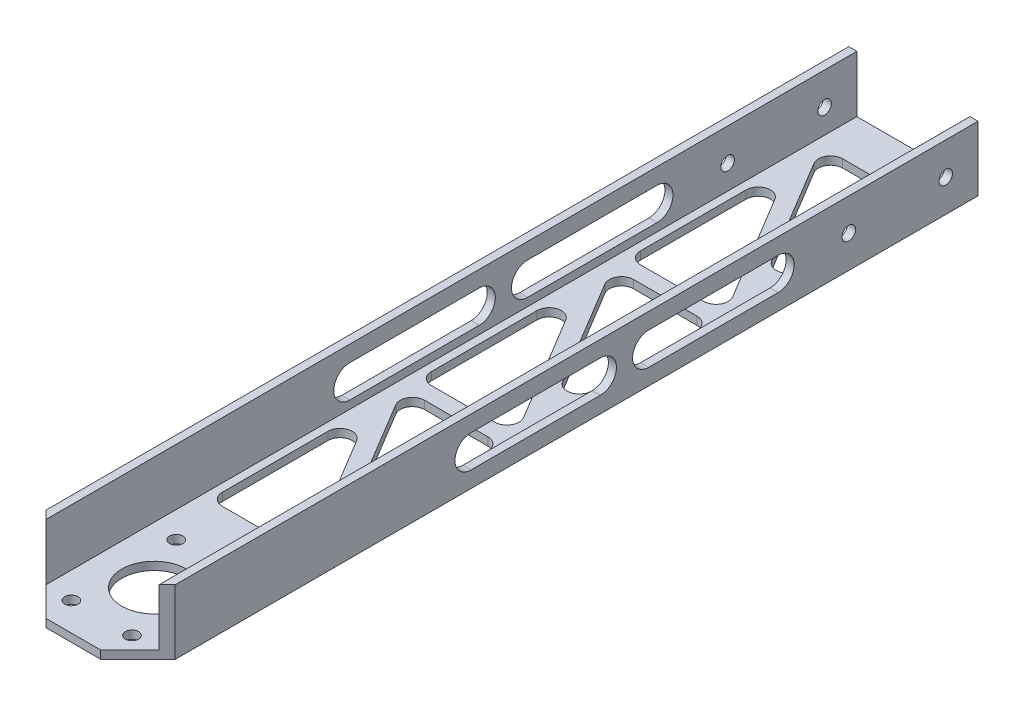
from build123d import *

# Parameters (mm, degrees)
BOSS_EXTRUDE1_DEPTH = 330.2
CUT_EXTRUDE1_REACH  = 337.049
SKETCH2_R           = 12.7
SKETCH3_R           = 2.667
CUT_EXTRUDE2_DEPTH  = 336.04901134
CUT_EXTRUDE3_REACH  = 337.049
SKETCH4_R           = 2.5908
CUT_EXTRUDE4_REACH  = 337.049
CUT_EXTRUDE5_DEPTH  = 336.04901134
CUT_EXTRUDE6_DEPTH  = 336.04901134


with BuildPart() as part:
    # Sketch1 → Boss-Extrude1 (new body)
    with BuildSketch(Plane.XY):
        Polygon((47.625, 3.175), (47.625, 25.4), (50.8, 25.4), (50.8, 0), (0, 0), (0, 25.4), (3.175, 25.4), (3.175, 3.175), align=None)
    extrude(amount=BOSS_EXTRUDE1_DEPTH)

    # Sketch2 → Cut-Extrude1 (cut, up to next)
    with BuildSketch(Plane.XZ, mode=Mode.PRIVATE) as cut_extrude1_sk1:
        with Locations((25.4, 298.45)):
            Circle(SKETCH2_R)
    cut_extrude1_tool1 = extrude(cut_extrude1_sk1.sketch, amount=-CUT_EXTRUDE1_REACH, mode=Mode.PRIVATE) & part.part
    add(cut_extrude1_tool1.solids().sort_by_distance((25.4, 0, 298.45))[0], mode=Mode.SUBTRACT)

    # Sketch3 → Cut-Extrude2 (cut, through all)
    with BuildSketch(Plane(origin=(50.8, 0, 0), x_dir=(0, 0, -1), z_dir=(1, 0, 0))):
        with Locations((-12.7, 12.7)):
            Circle(SKETCH3_R)
        with Locations((-50.8, 12.7)):
            Circle(SKETCH3_R)
    extrude(amount=-CUT_EXTRUDE2_DEPTH, mode=Mode.SUBTRACT)

    # Sketch4 → Cut-Extrude3 (cut, up to next)
    with BuildSketch(Plane.XZ, mode=Mode.PRIVATE) as cut_extrude3_sk1:
        with Locations((13.49375, 277.827770072)):
            Circle(SKETCH4_R)
    cut_extrude3_tool1 = extrude(cut_extrude3_sk1.sketch, amount=-CUT_EXTRUDE3_REACH, mode=Mode.PRIVATE) & part.part
    # Sketch4 → Cut-Extrude3 (cut, up to next)
    with BuildSketch(Plane.XZ, mode=Mode.PRIVATE) as cut_extrude3_sk2:
        with Locations((37.30625, 277.827770072)):
            Circle(SKETCH4_R)
    cut_extrude3_tool2 = extrude(cut_extrude3_sk2.sketch, amount=-CUT_EXTRUDE3_REACH, mode=Mode.PRIVATE) & part.part
    # Sketch4 → Cut-Extrude3 (cut, up to next)
    with BuildSketch(Plane.XZ, mode=Mode.PRIVATE) as cut_extrude3_sk3:
        with Locations((13.49375, 319.072229928)):
            Circle(SKETCH4_R)
    cut_extrude3_tool3 = extrude(cut_extrude3_sk3.sketch, amount=-CUT_EXTRUDE3_REACH, mode=Mode.PRIVATE) & part.part
    # Sketch4 → Cut-Extrude3 (cut, up to next)
    with BuildSketch(Plane.XZ, mode=Mode.PRIVATE) as cut_extrude3_sk4:
        with Locations((37.30625, 319.072229928)):
            Circle(SKETCH4_R)
    cut_extrude3_tool4 = extrude(cut_extrude3_sk4.sketch, amount=-CUT_EXTRUDE3_REACH, mode=Mode.PRIVATE) & part.part
    add(cut_extrude3_tool1.solids().sort_by_distance((13.49375, 0, 277.82777))[0], mode=Mode.SUBTRACT)
    add(cut_extrude3_tool2.solids().sort_by_distance((37.30625, 0, 277.82777))[0], mode=Mode.SUBTRACT)
    add(cut_extrude3_tool3.solids().sort_by_distance((13.49375, 0, 319.07223))[0], mode=Mode.SUBTRACT)
    add(cut_extrude3_tool4.solids().sort_by_distance((37.30625, 0, 319.07223))[0], mode=Mode.SUBTRACT)

    # Sketch5 → Cut-Extrude4 (cut, up to next)
    with BuildSketch(Plane.XZ, mode=Mode.PRIVATE) as cut_extrude4_sk1:
        with BuildLine():
            Line((40.122328379, 85.773383183), (15.196310059, 44.230019316))
            ThreePointArc((15.196310059, 44.230019316), (9.841228816, 42.090613006), (6.35, 46.680305352))
            Line((6.35, 46.680305352), (6.35, 88.223669219))
            ThreePointArc((6.35, 88.223669219), (7.744903955, 91.591265264), (11.1125, 92.986169219))
            Line((11.1125, 92.986169219), (36.03851832, 92.986169219))
            ThreePointArc((36.03851832, 92.986169219), (40.182845376, 90.570147325), (40.122328379, 85.773383183))
        make_face()
    cut_extrude4_tool1 = extrude(cut_extrude4_sk1.sketch, amount=-CUT_EXTRUDE4_REACH, mode=Mode.PRIVATE) & part.part
    # Sketch5 → Cut-Extrude4 (cut, up to next)
    with BuildSketch(Plane.XZ, mode=Mode.PRIVATE) as cut_extrude4_sk2:
        with BuildLine():
            Line((14.76148168, 17.143987708), (39.6875, 17.143987708))
            ThreePointArc((39.6875, 17.143987708), (43.055096045, 18.538891662), (44.45, 21.906487708))
            Line((44.45, 21.906487708), (44.45, 63.449851575))
            ThreePointArc((44.45, 63.449851575), (40.958771184, 68.03954392), (35.603689941, 65.90013761))
            Line((35.603689941, 65.90013761), (10.677671621, 24.356773743))
            ThreePointArc((10.677671621, 24.356773743), (10.617154624, 19.560009601), (14.76148168, 17.143987708))
        make_face()
    cut_extrude4_tool2 = extrude(cut_extrude4_sk2.sketch, amount=-CUT_EXTRUDE4_REACH, mode=Mode.PRIVATE) & part.part
    # Sketch5 → Cut-Extrude4 (cut, up to next)
    with BuildSketch(Plane.XZ, mode=Mode.PRIVATE) as cut_extrude4_sk3:
        with BuildLine():
            Line((40.122328379, 167.965564694), (15.196310059, 126.422200827))
            ThreePointArc((15.196310059, 126.422200827), (9.841228816, 124.282794517), (6.35, 128.872486862))
            Line((6.35, 128.872486862), (6.35, 170.415850729))
            ThreePointArc((6.35, 170.415850729), (7.744903955, 173.783446775), (11.1125, 175.178350729))
            Line((11.1125, 175.178350729), (36.03851832, 175.178350729))
            ThreePointArc((36.03851832, 175.178350729), (40.182845376, 172.762328836), (40.122328379, 167.965564694))
        make_face()
    cut_extrude4_tool3 = extrude(cut_extrude4_sk3.sketch, amount=-CUT_EXTRUDE4_REACH, mode=Mode.PRIVATE) & part.part
    # Sketch5 → Cut-Extrude4 (cut, up to next)
    with BuildSketch(Plane.XZ, mode=Mode.PRIVATE) as cut_extrude4_sk4:
        with BuildLine():
            Line((14.76148168, 99.336169219), (39.6875, 99.336169219))
            ThreePointArc((39.6875, 99.336169219), (43.055096045, 100.731073173), (44.45, 104.098669219))
            Line((44.45, 104.098669219), (44.45, 145.642033085))
            ThreePointArc((44.45, 145.642033085), (40.958771184, 150.231725431), (35.603689941, 148.092319121))
            Line((35.603689941, 148.092319121), (10.677671621, 106.548955254))
            ThreePointArc((10.677671621, 106.548955254), (10.617154624, 101.752191112), (14.76148168, 99.336169219))
        make_face()
    cut_extrude4_tool4 = extrude(cut_extrude4_sk4.sketch, amount=-CUT_EXTRUDE4_REACH, mode=Mode.PRIVATE) & part.part
    # Sketch5 → Cut-Extrude4 (cut, up to next)
    with BuildSketch(Plane.XZ, mode=Mode.PRIVATE) as cut_extrude4_sk5:
        with BuildLine():
            Line((40.122328379, 250.157746205), (15.196310059, 208.614382338))
            ThreePointArc((15.196310059, 208.614382338), (9.841228816, 206.474976028), (6.35, 211.064668373))
            Line((6.35, 211.064668373), (6.35, 252.60803224))
            ThreePointArc((6.35, 252.60803224), (7.744903955, 255.975628285), (11.1125, 257.37053224))
            Line((11.1125, 257.37053224), (36.03851832, 257.37053224))
            ThreePointArc((36.03851832, 257.37053224), (40.182845376, 254.954510346), (40.122328379, 250.157746205))
        make_face()
    cut_extrude4_tool5 = extrude(cut_extrude4_sk5.sketch, amount=-CUT_EXTRUDE4_REACH, mode=Mode.PRIVATE) & part.part
    # Sketch5 → Cut-Extrude4 (cut, up to next)
    with BuildSketch(Plane.XZ, mode=Mode.PRIVATE) as cut_extrude4_sk6:
        with BuildLine():
            Line((14.76148168, 181.528350729), (39.6875, 181.528350729))
            ThreePointArc((39.6875, 181.528350729), (43.055096045, 182.923254684), (44.45, 186.290850729))
            Line((44.45, 186.290850729), (44.45, 227.834214596))
            ThreePointArc((44.45, 227.834214596), (40.958771184, 232.423906942), (35.603689941, 230.284500631))
            Line((35.603689941, 230.284500631), (10.677671621, 188.741136765))
            ThreePointArc((10.677671621, 188.741136765), (10.617154624, 183.944372623), (14.76148168, 181.528350729))
        make_face()
    cut_extrude4_tool6 = extrude(cut_extrude4_sk6.sketch, amount=-CUT_EXTRUDE4_REACH, mode=Mode.PRIVATE) & part.part
    add(cut_extrude4_tool1.solids().sort_by_distance((19.256233, 0, 73.00095))[0], mode=Mode.SUBTRACT)
    add(cut_extrude4_tool2.solids().sort_by_distance((31.543767, 0, 37.129207))[0], mode=Mode.SUBTRACT)
    add(cut_extrude4_tool3.solids().sort_by_distance((19.256233, 0, 155.193132))[0], mode=Mode.SUBTRACT)
    add(cut_extrude4_tool4.solids().sort_by_distance((31.543767, 0, 119.321388))[0], mode=Mode.SUBTRACT)
    add(cut_extrude4_tool5.solids().sort_by_distance((19.256233, 0, 237.385313))[0], mode=Mode.SUBTRACT)
    add(cut_extrude4_tool6.solids().sort_by_distance((31.543767, 0, 201.51357))[0], mode=Mode.SUBTRACT)

    # Sketch6 → Cut-Extrude5 (cut, through all)
    with BuildSketch(Plane.ZY):
        with BuildLine():
            Line((78.616971835, 19.05), (129.416971835, 19.05))
            ThreePointArc((129.416971835, 19.05), (135.766971835, 12.7), (129.416971835, 6.35))
            Line((129.416971835, 6.35), (78.616971835, 6.35))
            ThreePointArc((78.616971835, 6.35), (72.266971835, 12.7), (78.616971835, 19.05))
        make_face()
        with BuildLine():
            Line((148.466971835, 19.05), (199.266971835, 19.05))
            ThreePointArc((199.266971835, 19.05), (205.616971835, 12.7), (199.266971835, 6.35))
            Line((199.266971835, 6.35), (148.466971835, 6.35))
            ThreePointArc((148.466971835, 6.35), (142.116971835, 12.7), (148.466971835, 19.05))
        make_face()
    extrude(amount=-CUT_EXTRUDE5_DEPTH, mode=Mode.SUBTRACT)

    # Sketch7 → Cut-Extrude6 (cut, through all)
    with BuildSketch(Plane.XZ):
        Polygon((0, 330.2), (0, 315.558408634), (14.641591366, 330.2), align=None)
        Polygon((36.158408634, 330.2), (50.8, 330.2), (50.8, 315.558408634), align=None)
    extrude(amount=-CUT_EXTRUDE6_DEPTH, mode=Mode.SUBTRACT)


solid = part.part
